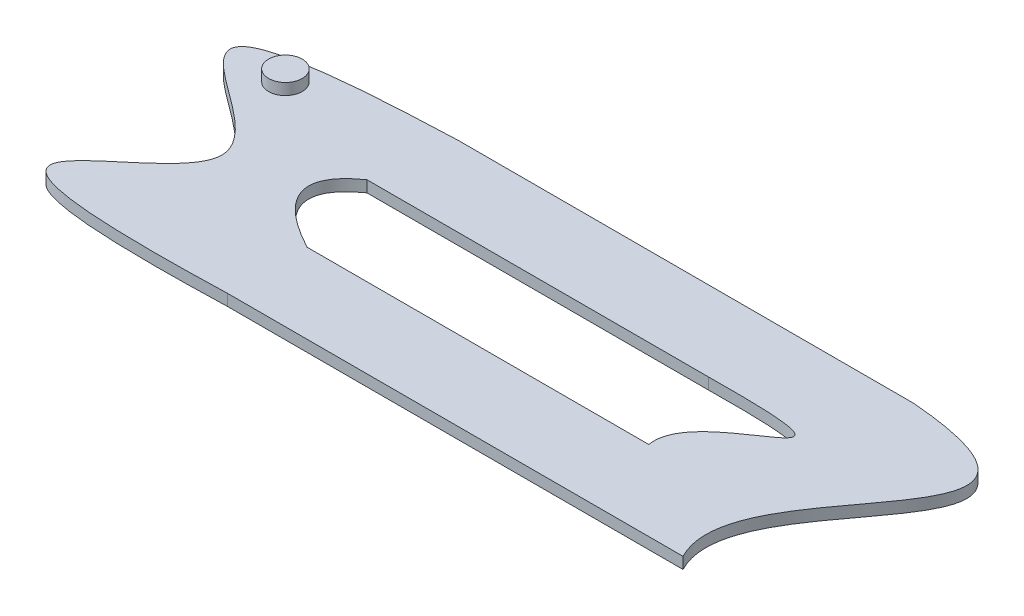
from build123d import *

# Parameters (mm, degrees)
BOSS_EXTRUDE1_DEPTH = 500
SKETCH2_R           = 737.131967784
BOSS_EXTRUDE2_DEPTH = 500


with BuildPart() as part:
    # Sketch1 → Boss-Extrude1 (new body)
    with BuildSketch(Plane(origin=(0, 0, 0), x_dir=(1, 0, 0), z_dir=(0, 1, 0))):
        with BuildLine():
            Line((-6181.00019884, 1570.986331736), (13818.99980116, 1570.986331736))
            add(Edge.make_bspline(
                [(13818.99980116, 1570.986331736), (24199.030602684, 720.005330283), (12166.456296154, -4701.916681883), (14574.118816667, -9307.579520644)],
                knots=[0, 0, 0, 0, 1, 1, 1, 1], degree=3))
            Line((14574.118816667, -9307.579520644), (-5425.881183333, -9307.579520644))
            add(Edge.make_bspline(
                [(-6181.00019884, 1570.986331736), (-22070.430852543, 1028.642824966), (23.791236712, -3734.082636988), (-21201.049425453, -9802.092161537), (-5425.881183333, -9307.579520644)],
                knots=[0, 0, 0, 0, 0.514320474, 1, 1, 1, 1], degree=3))
        make_face()
        with BuildLine():
            Line((-6681.453750893, -1929.013668264), (8318.546249107, -1929.013668264))
            add(Edge.make_bspline(
                [(8318.546249107, -1929.013668264), (17100.597161775, -1833.877168008), (9076.045948701, -3004.758600418), (9571.357343017, -5807.579520644)],
                knots=[0, 0, 0, 0, 1, 1, 1, 1], degree=3))
            Line((9571.357343017, -5807.579520644), (-5428.642656983, -5807.579520644))
            add(Edge.make_bspline(
                [(-6681.453750893, -1929.013668264), (-9266.005474761, -3764.961992578), (-5428.642656983, -5807.579520644)],
                knots=[0, 0, 0, 1, 1, 1], degree=2))
        make_face(mode=Mode.SUBTRACT)
    extrude(amount=BOSS_EXTRUDE1_DEPTH)

    # Sketch2 → Boss-Extrude2 (add)
    with BuildSketch(Plane(origin=(0, 500, 0), x_dir=(1, 0, 0), z_dir=(0, 1, 0))):
        with Locations((-12186.749533017, 0)):
            Circle(SKETCH2_R)
    extrude(amount=BOSS_EXTRUDE2_DEPTH)


solid = part.part
